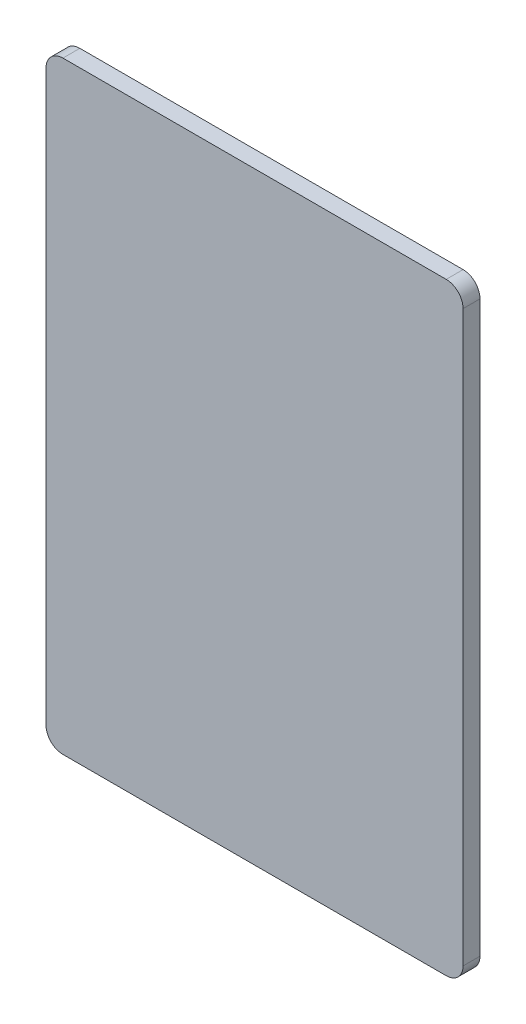
from build123d import *

# Parameters (mm, degrees)
IZIM1_W            = 74
IZIM1_H            = 107
TABAN_FLAN_1_DEPTH = 3
RADYUS1_R          = 3


# Sheet-metal steps are written as plain solids
with BuildPart() as part:
    # Çizim1 → Taban-Flanş1 (new body)
    with BuildSketch(Plane.XY):
        Rectangle(IZIM1_W, IZIM1_H)
    extrude(amount=-TABAN_FLAN_1_DEPTH)

    # Radyus1
    radyus1_edges = [part.edges().sort_by_distance(p)[0] for p in [
        (37, -53.5, -1.5),
        (-37, -53.5, -1.5),
        (-37, 53.5, -1.5),
        (37, 53.5, -1.5),
    ]]
    fillet(radyus1_edges, radius=RADYUS1_R)


solid = part.part
